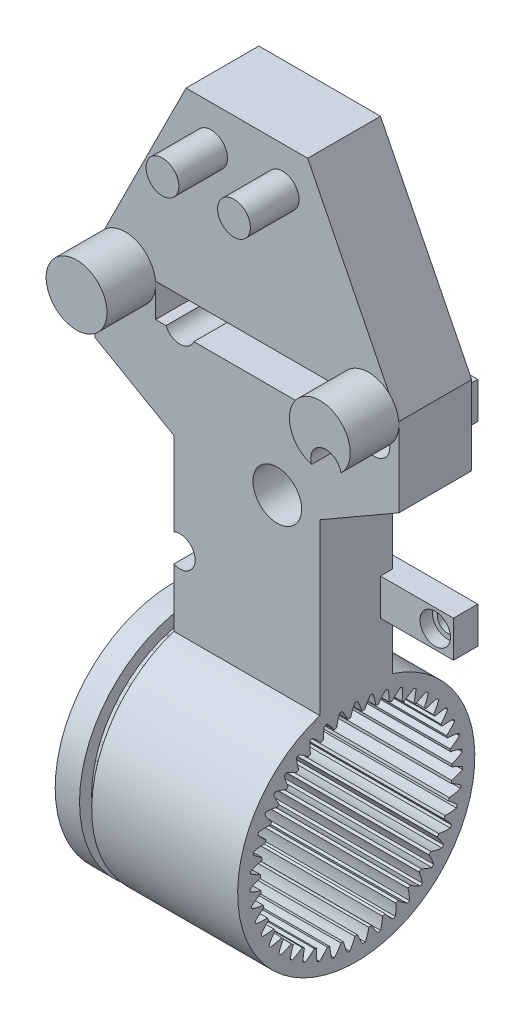
from build123d import *

# Parameters (mm, degrees)
BASPROSKE_W            = 78.047300112
BASPROSKE_H            = 4.5264
TOOTHCUT_DEPTH         = 102.176515302
TEETHCUTS_COUNT        = 43
TEETHCUTS_ANGLE        = 351.627906977
SCALE1_SCALE           = 0.373186685
SCALE2_SCALE           = 1.03
SKETCH2_R              = 19.499541689
SKETCH2_R_2            = 17.499541689
EXTRUDE_THIN1_DEPTH    = 4
BOSS_EXTRUDE2_DEPTH    = 24
BOSS_EXTRUDE3_DEPTH    = 11.9703915
SKETCH6_R              = 5
BOSS_EXTRUDE4_DEPTH    = 8
SKETCH7_R              = 4
CUT_EXTRUDE1_DEPTH     = 11.970392
SKETCH8_W              = 6
SKETCH8_H              = 6
BOSS_EXTRUDE5_DEPTH    = 2
CUT_EXTRUDE2_START     = -21.970391513
CUT_EXTRUDE2_OUTLINE_R = 1.665
CUT_EXTRUDE2_DEPTH     = 21.970391513
SKETCH10_R             = 2.5
CUT_EXTRUDE3_DEPTH     = 20
EXTRUDE_THIN2_START    = -23.999999605
EXTRUDE_THIN2_DEPTH    = 23.999999605
SKETCH12_R             = 2.7
BOSS_EXTRUDE6_DEPTH    = 8


# Read off the part's stored shape, not the designer's step: Cut-Extrude2, Extrude-Thin2
with BuildPart() as part:
    # BasProSke → Base-Revolve (revolve)
    with BuildSketch(Plane(origin=(0, 0, 0), x_dir=(1, 0, 0), z_dir=(0, 1, 0)), mode=Mode.PRIVATE) as base_revolve_sk:
        with Locations((39.023650056, 43.2632)):
            Rectangle(BASPROSKE_W, BASPROSKE_H)
    revolve(base_revolve_sk.sketch.rotate(Axis((-10, 0, 0), (1, 0, 0)), 180), axis=Axis((-10, 0, 0), (1, 0, 0)))

    # TooCutSke → ToothCut (cut, through all)
    with BuildSketch(Plane(origin=(0, 0, 0), x_dir=(0, 0, -1), z_dir=(1, 0, 0))):
        with BuildLine():
            ThreePointArc((2.427408244, 40.90263481), (1.622102306, 43.254489753), (0.55070415, 45.497667258))
            ThreePointArc((0.55070415, 45.497667258), (0, 45.501), (-0.55070415, 45.497667258))
            ThreePointArc((-0.55070415, 45.497667258), (-1.622102306, 43.254489753), (-2.427408244, 40.90263481))
            ThreePointArc((-2.427408244, 40.90263481), (0, 40.9746), (2.427408244, 40.90263481))
        make_face()
    toothcut = extrude(amount=TOOTHCUT_DEPTH, mode=Mode.SUBTRACT)

    # TeethCuts: ToothCut ×43 about axis
    teethcuts_axis = Axis((-10, 0, 0), (1, 0, 0))
    for i in range(1, TEETHCUTS_COUNT):
        add(toothcut.rotate(teethcuts_axis, i * TEETHCUTS_ANGLE / (TEETHCUTS_COUNT - 1)), mode=Mode.SUBTRACT)


with BuildPart() as part_1:
    # Scale1: scaled about (39.023650056, 0, 0)
    add(part.part.scale(SCALE1_SCALE).moved(Location((24.460543452, 0, 0))))


with BuildPart() as part_2:
    # Scale2: scaled about (39.023650056, 0, 0)
    add(part_1.part.scale(SCALE2_SCALE).moved(Location((-1.170709502, 0, 0))))



with BuildPart() as body_2:
    # Sketch2 → Extrude-Thin1 (new body)
    with BuildSketch(Plane.ZY.offset(-24.023650253)):
        Circle(SKETCH2_R)
        Circle(SKETCH2_R_2, mode=Mode.SUBTRACT)
    extrude(amount=-EXTRUDE_THIN1_DEPTH)


with BuildPart() as body_3:
    # Sketch4 → Boss-Extrude2 (new, through all)
    with BuildSketch(Plane(origin=(30.023650253, 0, 0), x_dir=(0, 0, -1), z_dir=(1, 0, 0))):
        with BuildLine():
            Line((-5.985195757, 61.444190192), (5.985195757, 61.444190192))
            Line((5.985195757, 61.444190192), (5.985195757, 16.444190192))
            ThreePointArc((5.985195757, 16.444190192), (0, 17.499541689), (-5.985195757, 16.444190192))
            Line((-5.985195757, 16.444190192), (-5.985195757, 61.444190192))
        make_face()
    extrude(amount=BOSS_EXTRUDE2_DEPTH)

    # Sketch5 → Boss-Extrude3 (add)
    with BuildSketch(Plane.XY.offset(5.985195757)):
        Polygon((30.023650253, 46.444190192), (17.023650056, 53.927504623), (17.023650056, 66.91737825), (32.023650056, 96.91737825), (42.023650056, 96.91737825), (52.023650056, 96.91737825), (67.023650056, 66.91737825), (67.023650056, 53.927504623), (54.023649859, 46.444190192), (54.023649859, 61.444190192), (57.023650056, 61.444190192), (57.023650056, 66.91737825), (27.023650056, 66.91737825), (27.023650056, 61.444190192), (30.023650253, 61.444190192), align=None)
    extrude(amount=-BOSS_EXTRUDE3_DEPTH)

    # Sketch6 → Boss-Extrude4 (add)
    with BuildSketch(Plane.XY.offset(5.985195757)):
        with Locations((22.023650056, 66.444190192)):
            Circle(SKETCH6_R)
        with Locations((62.023650056, 66.444190192)):
            Circle(SKETCH6_R)
    extrude(amount=BOSS_EXTRUDE4_DEPTH)

    # Sketch7 → Cut-Extrude1 (cut)
    with BuildSketch(Plane.XY.offset(5.985195757)):
        with Locations((47.023650056, 46.444190192)):
            Circle(SKETCH7_R)
    extrude(amount=-CUT_EXTRUDE1_DEPTH, mode=Mode.SUBTRACT)

    # Sketch8 → Boss-Extrude5 (add, symmetric)
    with BuildSketch(Plane(origin=(0, 0, -5.985195757), x_dir=(-1, 0, 0), z_dir=(0, 0, -1))):
        Polygon((-54.023649859, 27.444190192), (-66.023650056, 27.444190192), (-66.023650056, 33.444190192), (-49.523649859, 33.444190192), (-46.523649859, 33.444190192), (-46.523649859, 27.444190192), align=None)
        with Locations((-31.023650056, 30.444190192)):
            Rectangle(SKETCH8_W, SKETCH8_H)
        with Locations((-63.023650056, 62.444190192)):
            Rectangle(SKETCH8_W, SKETCH8_H)
        with Locations((-31.023650056, 62.444190192)):
            Rectangle(SKETCH8_W, SKETCH8_H)
    extrude(amount=BOSS_EXTRUDE5_DEPTH, both=True)

    # Cut-Extrude2 outline → Cut-Extrude2 (cut)
    with BuildSketch(Plane(origin=(0, 0, -7.985195757), x_dir=(-1, 0, 0), z_dir=(0, 0, -1)).offset(CUT_EXTRUDE2_START)):
        with Locations((-31.023650056, 62.444190192)):
            Circle(CUT_EXTRUDE2_OUTLINE_R)
        with Locations((-63.023650056, 62.444190192)):
            Circle(CUT_EXTRUDE2_OUTLINE_R)
        with Locations((-31.023650056, 30.444190192)):
            Circle(CUT_EXTRUDE2_OUTLINE_R)
        with Locations((-63.023650056, 30.444190192)):
            Circle(CUT_EXTRUDE2_OUTLINE_R)
    extrude(amount=CUT_EXTRUDE2_DEPTH, mode=Mode.SUBTRACT)

    # Sketch10 → Cut-Extrude3 (cut)
    with BuildSketch(Plane.XY.offset(13.985195757)):
        with Locations((31.023650056, 62.444190192)):
            Circle(SKETCH10_R)
        with Locations((31.023650056, 30.444190192)):
            Circle(SKETCH10_R)
        with Locations((63.023650056, 30.444190192)):
            Circle(SKETCH10_R)
        with Locations((63.023650056, 62.444190192)):
            Circle(SKETCH10_R)
    extrude(amount=-CUT_EXTRUDE3_DEPTH, mode=Mode.SUBTRACT)


with BuildPart() as part_3:
    add(part_2.part)

    add(body_3.part)  # Extrude-Thin2 merges body 3
    # Extrude-Thin2 outline → Extrude-Thin2 (add)
    with BuildSketch(Plane.ZY.offset(-30.023650253).offset(EXTRUDE_THIN2_START)):
        with BuildLine():
            Line((-5.985195757, 16.444190192), (-5.985195757, 18.558274646))
            ThreePointArc((-5.985195757, 18.558274646), (0, -19.499541689), (5.985195757, 18.558274646))
            Line((5.985195757, 18.558274646), (5.985195757, 16.444190192))
            ThreePointArc((5.985195757, 16.444190192), (0, -17.499541689), (-5.985195757, 16.444190192))
        make_face()
    extrude(amount=EXTRUDE_THIN2_DEPTH)

    # Sketch12 → Boss-Extrude6 (add)
    with BuildSketch(Plane.XY.offset(5.985195757)):
        with Locations(Location((36.141395741, 90.320034105, 0), (0, 0, 180))):
            Circle(SKETCH12_R)
        with Locations(Location((47.905904371, 90.320034105, 0), (0, 0, 180))):
            Circle(SKETCH12_R)
    extrude(amount=BOSS_EXTRUDE6_DEPTH)


solid = Compound([body_2.part, part_3.part])
